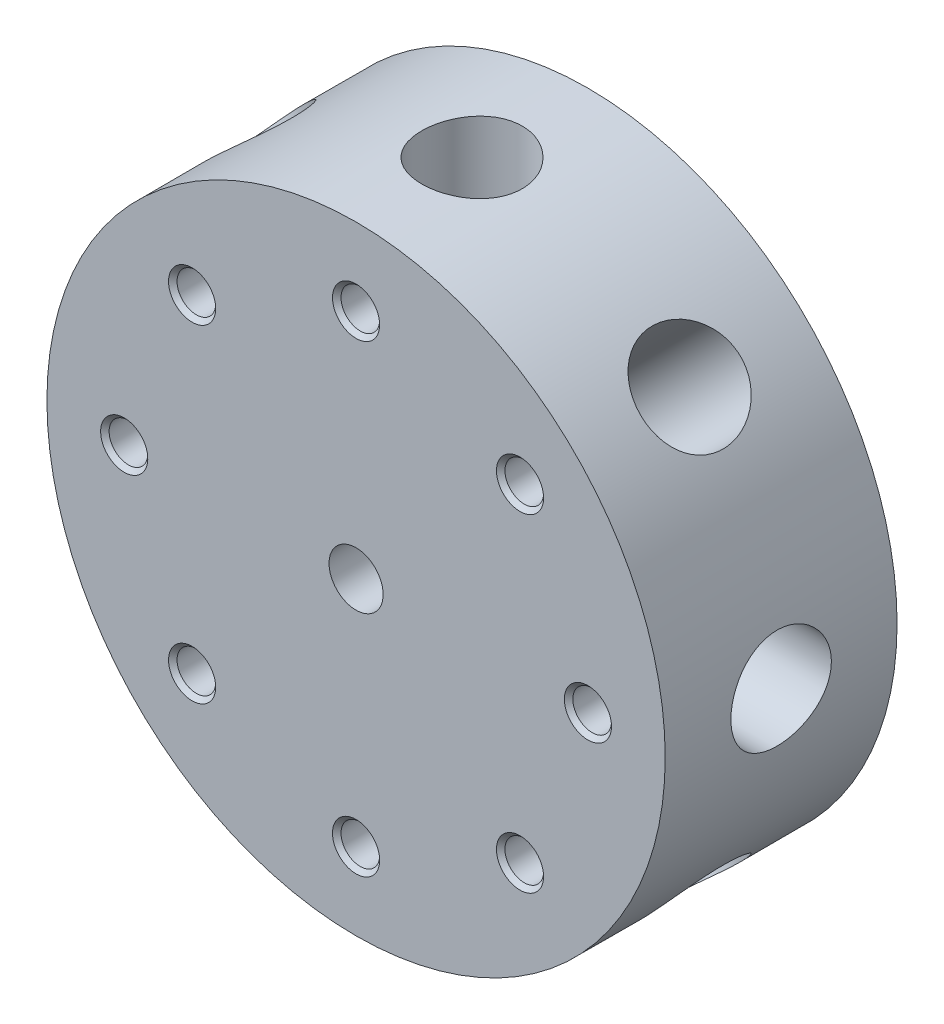
from build123d import *

# Parameters (mm, degrees)
SKETCH1_R         = 40
BLANK_DEPTH       = 15
CIRPATTERN1_COUNT = 8
SKETCH5_R         = 3.5
SHAFT_HOLE_DEPTH  = 65.031242546


# Read off the part's stored shape, not the designer's step: M6x1.0 Tapped Hole for grub screw
with BuildPart() as part:
    # Sketch1 → Blank (new, symmetric)
    with BuildSketch(Plane.XY):
        Circle(SKETCH1_R)
    extrude(amount=BLANK_DEPTH, both=True)

    # Sketch6 → Ø12.0 stem hole (revolve, cut)
    with BuildSketch(Plane(origin=(0, 40, 0), x_dir=(0, 0, 1), z_dir=(1, 0, 0))):
        Polygon((0, 0), (0, 25.905594024), (6.5, 22), (6.5, 0), align=None)
    f_12_0_stem_hole = revolve(axis=Axis((0, 46.35, 0), (0, -1, 0)), mode=Mode.SUBTRACT)

    # M6x1.0 Tapped Hole for grub screw outlin → M6x1.0 Tapped Hole for grub screw (revolve, cut)
    with BuildSketch(Plane.XZ.offset(-30)):
        Polygon((0, 5.999783422), (2.5, 5.999783422), (2.5, 14.45), (3.05, 15), (0, 15), align=None)
    m6x1_0_tapped_hole_for_grub_screw = revolve(axis=Axis((0, 30, 0), (0, 0, 1)), mode=Mode.SUBTRACT)

    # CirPattern1: Ø12.0 stem hole, M6x1.0 Tapped Hole for grub screw ×8 about axis
    cirpattern1_axis = Axis((0, 0, 0), (0, 0, 1))
    add([f_12_0_stem_hole.rotate(cirpattern1_axis, i * 360 / CIRPATTERN1_COUNT) for i in range(1, CIRPATTERN1_COUNT)], mode=Mode.SUBTRACT)
    add([m6x1_0_tapped_hole_for_grub_screw.rotate(cirpattern1_axis, i * 360 / CIRPATTERN1_COUNT) for i in range(1, CIRPATTERN1_COUNT)], mode=Mode.SUBTRACT)

    # Sketch5 → shaft_hole (cut, through all)
    with BuildSketch(Plane.XY.offset(15)):
        Circle(SKETCH5_R)
    extrude(amount=-SHAFT_HOLE_DEPTH, mode=Mode.SUBTRACT)


solid = part.part
